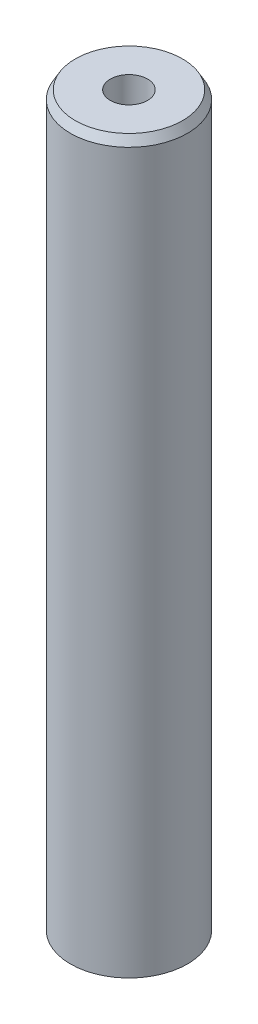
from build123d import *
from OCP.BRepFilletAPI import BRepFilletAPI_MakeChamfer

# Parameters (mm, degrees)
SKETCH1_R           = 30
BOSS_EXTRUDE1_DEPTH = 375.821542556
SKETCH2_R           = 9.539275895
CUT_EXTRUDE1_DEPTH  = 379.208714666
CHAMFER1_SIZE       = 4.372754934
CHAMFER1_SIZE2      = 2.524611238


with BuildPart() as part:
    # Sketch1 → Boss-Extrude1 (new body)
    with BuildSketch(Plane(origin=(0, 0, 0), x_dir=(1, 0, 0), z_dir=(0, 1, 0))):
        Circle(SKETCH1_R)
    extrude(amount=BOSS_EXTRUDE1_DEPTH)

    # Sketch2 → Cut-Extrude1 (cut, through all)
    with BuildSketch(Plane(origin=(0, 0, 0), x_dir=(1, 0, 0), z_dir=(0, 1, 0))):
        Circle(SKETCH2_R)
    extrude(amount=CUT_EXTRUDE1_DEPTH, mode=Mode.SUBTRACT)

    # Chamfer1: one chamfer whose edges measure the first distance from different faces: ONE call of the kernel's chamfer builder (chamfer() names one face for all edges)
    chamfer1_edges_1 = [part.edges().sort_by_distance(p)[0] for p in [
        (-30, 375.821542556, 0),
    ]]
    chamfer1_side_1 = [part.faces().sort_by_distance(p)[0] for p in [
        (-30, 187.910771278, 0),
    ]]
    chamfer1_edges_2 = [part.edges().sort_by_distance(p)[0] for p in [
        (-30, 0, 0),
    ]]
    chamfer1_side_2 = [part.faces().sort_by_distance(p)[0] for p in [
        (-29.151471863, 0, 0),
    ]]
    chamfer1 = BRepFilletAPI_MakeChamfer(part.part.solid().wrapped)
    for e in chamfer1_edges_1:
        chamfer1.Add(CHAMFER1_SIZE, CHAMFER1_SIZE2, e.wrapped, chamfer1_side_1[0].wrapped)  # the first distance lies on this face
    for e in chamfer1_edges_2:
        chamfer1.Add(CHAMFER1_SIZE, CHAMFER1_SIZE2, e.wrapped, chamfer1_side_2[0].wrapped)  # the first distance lies on this face
    add(Compound.cast(chamfer1.Shape()), mode=Mode.REPLACE)


solid = part.part
